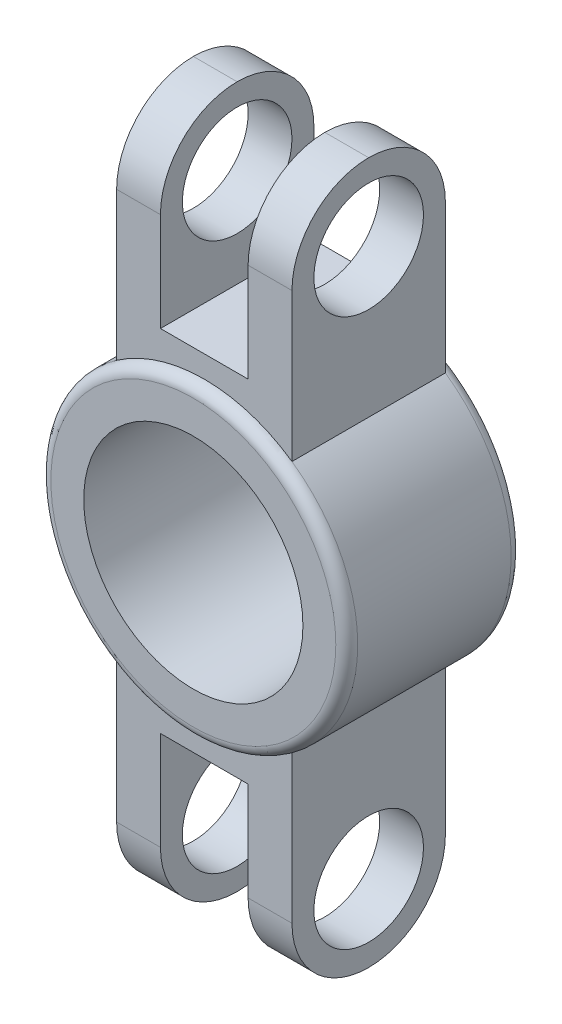
from build123d import *

# Parameters (mm, degrees)
SKETCH1_R            = 8.89
SKETCH1_R_2          = 6.35
BOSS_EXTRUDE1_DEPTH  = 5.08
FILLET1_R            = 0.635
SKETCH2_W            = 8.89
SKETCH2_H            = 3.81
BOSS_EXTRUDE2_DEPTH  = 3.81
BOSS_EXTRUDE3_START  = -3.175
SKETCH3_W            = 2.54
SKETCH3_H            = 8.89
BOSS_EXTRUDE3_DEPTH  = 13.335
FILLET2_R            = 4.445
SKETCH4_R            = 3.175
CUT_EXTRUDE1_DEPTH   = 10.16
FILLET2_OF_MIRROR1_R = 4.445


with BuildPart() as part:
    # Sketch1 → Boss-Extrude1 (new, symmetric)
    with BuildSketch(Plane.XY):
        Circle(SKETCH1_R)
        Circle(SKETCH1_R_2, mode=Mode.SUBTRACT)
    extrude(amount=BOSS_EXTRUDE1_DEPTH, both=True)

    # Fillet1
    fillet1_edges = [part.edges().sort_by_distance(p)[0] for p in [
        (-8.89, 0, -5.08),
        (-8.89, 0, 5.08),
    ]]
    fillet(fillet1_edges, radius=FILLET1_R)

    # Sketch2 → Boss-Extrude2 (add, symmetric)
    with BuildSketch(Plane(origin=(0, 0, 0), x_dir=(0, 0, -1), z_dir=(1, 0, 0))):
        with Locations((0, 8.255)):
            Rectangle(SKETCH2_W, SKETCH2_H)
    boss_extrude2 = extrude(amount=BOSS_EXTRUDE2_DEPTH, both=True)

    # Sketch3 → Boss-Extrude3 (add)
    with BuildSketch(Plane(origin=(0, 10.16, 0), x_dir=(1, 0, 0), z_dir=(0, 1, 0)).offset(BOSS_EXTRUDE3_START)):
        with Locations((3.81, 0)):
            Rectangle(SKETCH3_W, SKETCH3_H)
        with Locations((-3.81, 0)):
            Rectangle(SKETCH3_W, SKETCH3_H)
    boss_extrude3 = extrude(amount=BOSS_EXTRUDE3_DEPTH)

    # Fillet2
    fillet2_edges = [part.edges().sort_by_distance(p)[0] for p in [
        (-3.81, 20.32, -4.445),
        (-3.81, 20.32, 4.445),
        (3.81, 20.32, -4.445),
        (3.81, 20.32, 4.445),
    ]]
    fillet(fillet2_edges, radius=FILLET2_R - 0.0001)  # a hair under: the kernel refuses the full size

    # Sketch4 → Cut-Extrude1 (cut)
    with BuildSketch(Plane(origin=(5.08, 0, 0), x_dir=(0, 0, -1), z_dir=(1, 0, 0))):
        with Locations((0, 15.875)):
            Circle(SKETCH4_R)
    cut_extrude1 = extrude(amount=-CUT_EXTRUDE1_DEPTH, mode=Mode.SUBTRACT)

    # Mirror1: Boss-Extrude2, Boss-Extrude3, Cut-Extrude1 across plane
    add(boss_extrude2.mirror(Plane.ZX))
    add(boss_extrude3.mirror(Plane.ZX))
    add(cut_extrude1.mirror(Plane.ZX), mode=Mode.SUBTRACT)

    # Fillet2 of Mirror1
    fillet2_of_mirror1_edges = [part.edges().sort_by_distance(p)[0] for p in [
        (-3.81, -20.32, -4.445),
        (-3.81, -20.32, 4.445),
        (3.81, -20.32, -4.445),
        (3.81, -20.32, 4.445),
    ]]
    fillet(fillet2_of_mirror1_edges, radius=FILLET2_OF_MIRROR1_R - 0.0001)  # a hair under: the kernel refuses the full size


solid = part.part
